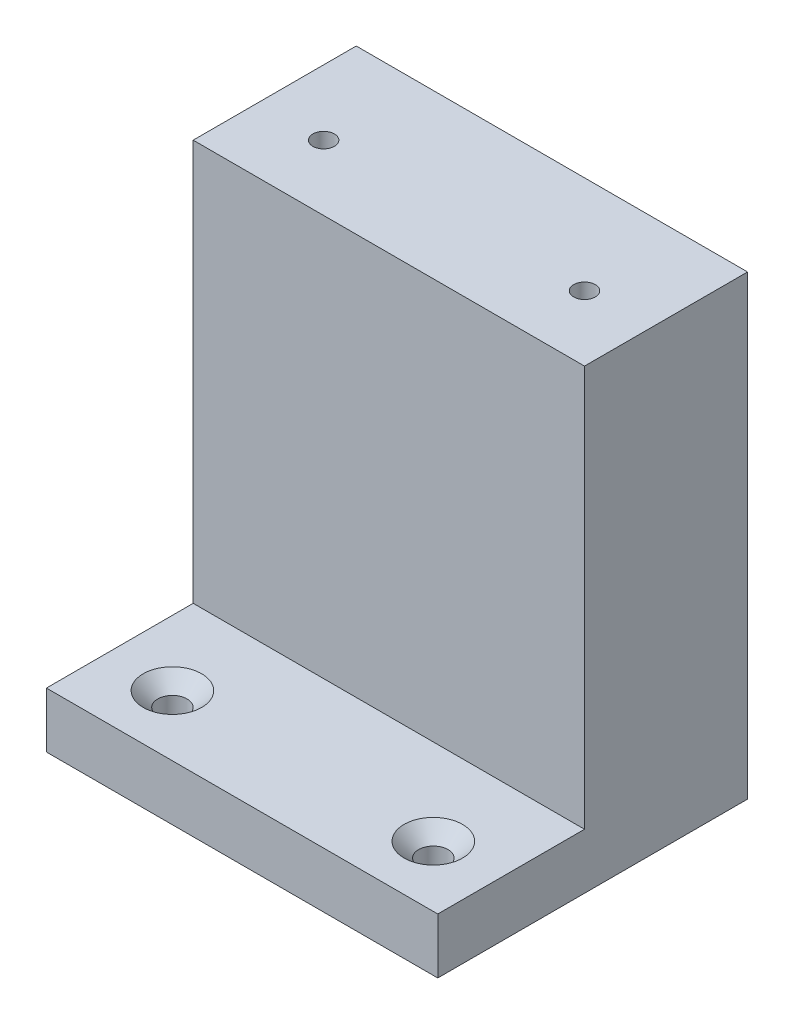
from build123d import *

# Parameters (mm, degrees)
SKETCH1_W                     = 60
SKETCH1_H                     = 40
BOSS_EXTRUDE1_DEPTH           = 70
SKETCH2_W                     = 15
SKETCH2_H                     = 61.5
CUT_EXTRUDE1_DEPTH            = 90
M4X0_7_TAPPED_HOLE1_D         = 3.3
M4X0_7_TAPPED_HOLE1_DEPTH     = 10
M4X0_7_TAPPED_HOLE1_TIP       = 0.991420021
M4X0_7_TAPPED_HOLE2_D         = 3.3
M4X0_7_TAPPED_HOLE2_DEPTH     = 10
M4X0_7_TAPPED_HOLE2_TIP       = 0.991420021
SKETCH13_W                    = 60
SKETCH13_H                    = 8.5
BOSS_EXTRUDE2_DEPTH           = 7.5
CSK_FOR_M4_SFHCS2_D           = 4.5
CSK_FOR_M4_SFHCS2_CSINK_D     = 8.96
CSK_FOR_M4_SFHCS2_CSINK_ANGLE = 90


with BuildPart() as part:
    # Sketch1 → Boss-Extrude1 (new body)
    with BuildSketch(Plane(origin=(0, 0, 0), x_dir=(1, 0, 0), z_dir=(0, 1, 0))):
        Rectangle(SKETCH1_W, SKETCH1_H)
    extrude(amount=BOSS_EXTRUDE1_DEPTH)

    # Sketch2 → Cut-Extrude1 (cut)
    with BuildSketch(Plane(origin=(30, 0, 0), x_dir=(0, 0, -1), z_dir=(1, 0, 0))):
        with Locations((-12.5, 39.25)):
            Rectangle(SKETCH2_W, SKETCH2_H)
    extrude(amount=-CUT_EXTRUDE1_DEPTH, mode=Mode.SUBTRACT)

    # M4x0.7 Tapped Hole1
    with Locations(Plane(origin=(0, 0, -20), x_dir=(-1, 0, 0), z_dir=(0, 0, -1))):
        with Locations((20, 55), (-20, 15), (-20, 55), (20, 15)):
            Hole(M4X0_7_TAPPED_HOLE1_D / 2, depth=M4X0_7_TAPPED_HOLE1_DEPTH)
            with Locations((0, 0, -(M4X0_7_TAPPED_HOLE1_DEPTH + M4X0_7_TAPPED_HOLE1_TIP / 2))):  # 118° drill point
                Cone(0, M4X0_7_TAPPED_HOLE1_D / 2, M4X0_7_TAPPED_HOLE1_TIP, mode=Mode.SUBTRACT)

    # M4x0.7 Tapped Hole2
    with Locations(Plane(origin=(0, 70, 0), x_dir=(1, 0, 0), z_dir=(0, 1, 0))):
        with Locations((-20, 5), (20, 5)):
            Hole(M4X0_7_TAPPED_HOLE2_D / 2, depth=M4X0_7_TAPPED_HOLE2_DEPTH)
            with Locations((0, 0, -(M4X0_7_TAPPED_HOLE2_DEPTH + M4X0_7_TAPPED_HOLE2_TIP / 2))):  # 118° drill point
                Cone(0, M4X0_7_TAPPED_HOLE2_D / 2, M4X0_7_TAPPED_HOLE2_TIP, mode=Mode.SUBTRACT)

    # Sketch13 → Boss-Extrude2 (add)
    with BuildSketch(Plane.XY.offset(20)):
        with Locations((0, 4.25)):
            Rectangle(SKETCH13_W, SKETCH13_H)
    extrude(amount=BOSS_EXTRUDE2_DEPTH)

    # CSK for M4 SFHCS2 (through all)
    with Locations(Plane(origin=(0, 8.5, 0), x_dir=(1, 0, 0), z_dir=(0, 1, 0))):
        with Locations((-20, -18.18), (20, -18.18)):
            CounterSinkHole(CSK_FOR_M4_SFHCS2_D / 2, CSK_FOR_M4_SFHCS2_CSINK_D / 2, counter_sink_angle=CSK_FOR_M4_SFHCS2_CSINK_ANGLE)


solid = part.part
